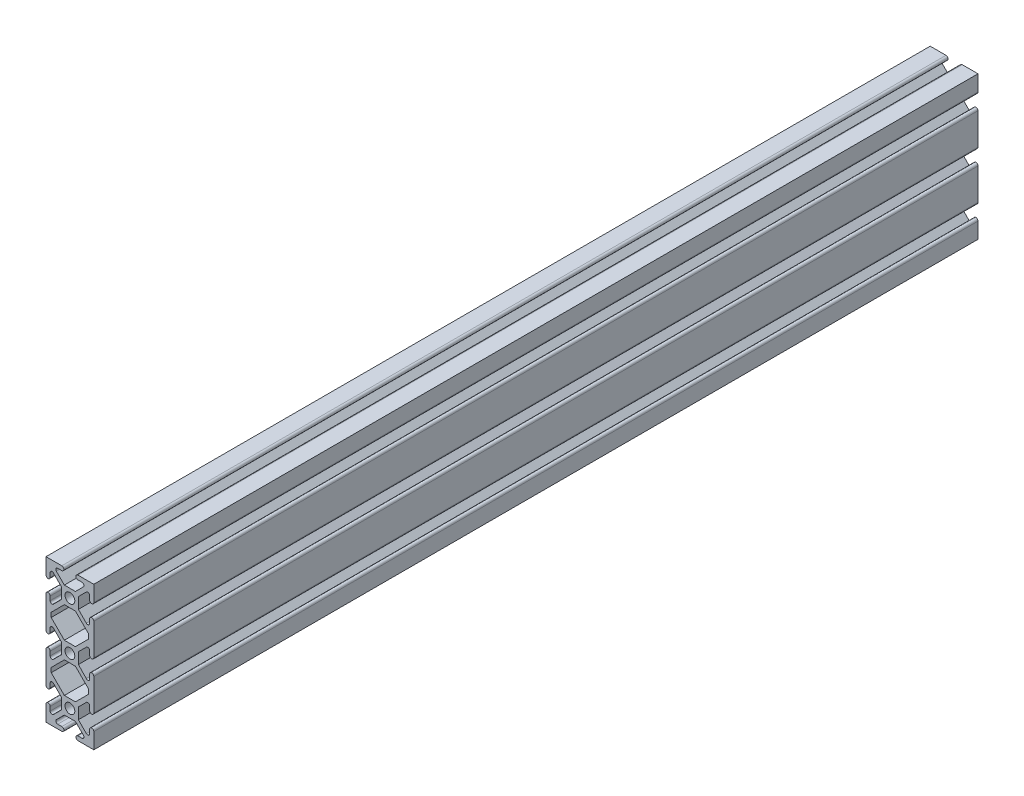
from build123d import *

# Parameters (mm, degrees)
SKETCH1_R           = 2.6035
BOSS_EXTRUDE1_DEPTH = 469.9


with BuildPart() as part:
    # Sketch1 → Boss-Extrude1 (new body)
    with BuildSketch(Plane.XY):
        with BuildLine():
            Line((-8.75577951, -7.193214945), (-4.5085, -2.945935435))
            Line((-4.5085, -2.945935435), (-4.5085, 2.945935435))
            Line((-4.5085, 2.945935435), (-8.75577951, 7.193214945))
            ThreePointArc((-8.75577951, 7.193214945), (-9.863006367, 7.413456061), (-10.4902, 6.474794456))
            Line((-10.4902, 6.474794456), (-10.4902, 4.302307889))
            ThreePointArc((-10.4902, 4.302307889), (-11.5951, 3.197407889), (-12.7, 4.302307889))
            Line((-12.7, 4.302307889), (-12.7, 21.097692111))
            ThreePointArc((-12.7, 21.097692111), (-11.5951, 22.202592111), (-10.4902, 21.097692111))
            Line((-10.4902, 21.097692111), (-10.4902, 18.925205544))
            ThreePointArc((-10.4902, 18.925205544), (-9.863006367, 17.986543939), (-8.75577951, 18.206785055))
            Line((-8.75577951, 18.206785055), (-4.5085, 22.454064565))
            Line((-4.5085, 22.454064565), (-4.5085, 28.345935435))
            Line((-4.5085, 28.345935435), (-8.75577951, 32.593214945))
            ThreePointArc((-8.75577951, 32.593214945), (-9.863006367, 32.813456061), (-10.4902, 31.874794456))
            Line((-10.4902, 31.874794456), (-10.4902, 29.702307889))
            ThreePointArc((-10.4902, 29.702307889), (-11.5951, 28.597407889), (-12.7, 29.702307889))
            Line((-12.7, 29.702307889), (-12.7, 38.1))
            Line((-12.7, 38.1), (-4.302307889, 38.1))
            ThreePointArc((-4.302307889, 38.1), (-3.197407889, 36.9951), (-4.302307889, 35.8902))
            Line((-4.302307889, 35.8902), (-6.474794456, 35.8902))
            ThreePointArc((-6.474794456, 35.8902), (-7.413456061, 35.263006367), (-7.193214945, 34.15577951))
            Line((-7.193214945, 34.15577951), (-2.945935435, 29.9085))
            Line((-2.945935435, 29.9085), (2.945935435, 29.9085))
            Line((2.945935435, 29.9085), (7.193214945, 34.15577951))
            ThreePointArc((7.193214945, 34.15577951), (7.413456061, 35.263006367), (6.474794456, 35.8902))
            Line((6.474794456, 35.8902), (4.302307889, 35.8902))
            ThreePointArc((4.302307889, 35.8902), (3.197407889, 36.9951), (4.302307889, 38.1))
            Line((4.302307889, 38.1), (12.7, 38.1))
            Line((12.7, 38.1), (12.7, 29.702307889))
            ThreePointArc((12.7, 29.702307889), (11.5951, 28.597407889), (10.4902, 29.702307889))
            Line((10.4902, 29.702307889), (10.4902, 31.874794456))
            ThreePointArc((10.4902, 31.874794456), (9.863006367, 32.813456061), (8.75577951, 32.593214945))
            Line((8.75577951, 32.593214945), (4.5085, 28.345935435))
            Line((4.5085, 28.345935435), (4.5085, 22.454064565))
            Line((4.5085, 22.454064565), (8.75577951, 18.206785055))
            ThreePointArc((8.75577951, 18.206785055), (9.863006367, 17.986543939), (10.4902, 18.925205544))
            Line((10.4902, 18.925205544), (10.4902, 21.097692082))
            ThreePointArc((10.4902, 21.097692082), (11.5951, 22.202592082), (12.7, 21.097692082))
            Line((12.7, 21.097692082), (12.7, 4.302307889))
            ThreePointArc((12.7, 4.302307889), (11.5951, 3.197407889), (10.4902, 4.302307889))
            Line((10.4902, 4.302307889), (10.4902, 6.474794456))
            ThreePointArc((10.4902, 6.474794456), (9.863006367, 7.413456061), (8.75577951, 7.193214945))
            Line((8.75577951, 7.193214945), (4.5085, 2.945935435))
            Line((4.5085, 2.945935435), (4.5085, -2.945935435))
            Line((4.5085, -2.945935435), (8.680690989, -7.266998826))
            ThreePointArc((8.680690989, -7.266998826), (9.897349311, -7.583329931), (10.4902, -6.474794456))
            Line((10.4902, -6.474794456), (10.4902, -4.302307889))
            ThreePointArc((10.4902, -4.302307889), (11.5951, -3.197407889), (12.7, -4.302307889))
            Line((12.7, -4.302307889), (12.7, -21.097692058))
            ThreePointArc((12.7, -21.097692058), (11.5951, -22.202592058), (10.4902, -21.097692058))
            Line((10.4902, -21.097692058), (10.4902, -18.925205544))
            ThreePointArc((10.4902, -18.925205544), (9.863006367, -17.986543939), (8.75577951, -18.206785055))
            Line((8.75577951, -18.206785055), (4.5085, -22.454064565))
            Line((4.5085, -22.454064565), (4.5085, -28.345935435))
            Line((4.5085, -28.345935435), (8.75577951, -32.593214945))
            ThreePointArc((8.75577951, -32.593214945), (9.863006367, -32.813456061), (10.4902, -31.874794456))
            Line((10.4902, -31.874794456), (10.4902, -29.702307918))
            ThreePointArc((10.4902, -29.702307918), (11.5951, -28.597407918), (12.7, -29.702307918))
            Line((12.7, -29.702307918), (12.7, -38.1))
            Line((12.7, -38.1), (4.302307889, -38.1))
            ThreePointArc((4.302307889, -38.1), (3.197407889, -36.9951), (4.302307889, -35.8902))
            Line((4.302307889, -35.8902), (6.474794456, -35.8902))
            ThreePointArc((6.474794456, -35.8902), (7.413456061, -35.263006367), (7.193214945, -34.15577951))
            Line((7.193214945, -34.15577951), (2.945935435, -29.9085))
            Line((2.945935435, -29.9085), (-2.945935435, -29.9085))
            Line((-2.945935435, -29.9085), (-7.193214945, -34.15577951))
            ThreePointArc((-7.193214945, -34.15577951), (-7.413456061, -35.263006367), (-6.474794456, -35.8902))
            Line((-6.474794456, -35.8902), (-4.302307889, -35.8902))
            ThreePointArc((-4.302307889, -35.8902), (-3.197407889, -36.9951), (-4.302307889, -38.1))
            Line((-4.302307889, -38.1), (-12.7, -38.1))
            Line((-12.7, -38.1), (-12.7, -29.702307889))
            ThreePointArc((-12.7, -29.702307889), (-11.5951, -28.597407889), (-10.4902, -29.702307889))
            Line((-10.4902, -29.702307889), (-10.4902, -31.874794456))
            ThreePointArc((-10.4902, -31.874794456), (-9.863006367, -32.813456061), (-8.75577951, -32.593214945))
            Line((-8.75577951, -32.593214945), (-4.5085, -28.345935435))
            Line((-4.5085, -28.345935435), (-4.5085, -22.454064565))
            Line((-4.5085, -22.454064565), (-8.75577951, -18.206785055))
            ThreePointArc((-8.75577951, -18.206785055), (-9.863006367, -17.986543939), (-10.4902, -18.925205544))
            Line((-10.4902, -18.925205544), (-10.4902, -21.097692111))
            ThreePointArc((-10.4902, -21.097692111), (-11.5951, -22.202592111), (-12.7, -21.097692111))
            Line((-12.7, -21.097692111), (-12.7, -4.302307889))
            ThreePointArc((-12.7, -4.302307889), (-11.5951, -3.197407889), (-10.4902, -4.302307889))
            Line((-10.4902, -4.302307889), (-10.4902, -6.474794456))
            ThreePointArc((-10.4902, -6.474794456), (-9.863006367, -7.413456061), (-8.75577951, -7.193214945))
        make_face()
        with Locations((0, 25.4)):
            Circle(SKETCH1_R, mode=Mode.SUBTRACT)
        with Locations((0, -25.4)):
            Circle(SKETCH1_R, mode=Mode.SUBTRACT)
        Circle(SKETCH1_R, mode=Mode.SUBTRACT)
        Polygon((-9.9314, 13.906035435), (-9.9314, 11.493964565), (-2.945935435, 4.5085), (2.945935435, 4.5085), (9.9314, 11.493964565), (9.9314, 13.906035435), (2.945935435, 20.8915), (-2.945935435, 20.8915), align=None, mode=Mode.SUBTRACT)
        Polygon((-9.9314, -11.493964565), (-9.9314, -13.906035435), (-2.945935435, -20.8915), (2.945935435, -20.8915), (9.9314, -13.906035435), (9.9314, -11.493964565), (2.945935435, -4.5085), (-2.945935435, -4.5085), align=None, mode=Mode.SUBTRACT)
    extrude(amount=-BOSS_EXTRUDE1_DEPTH)


solid = part.part
